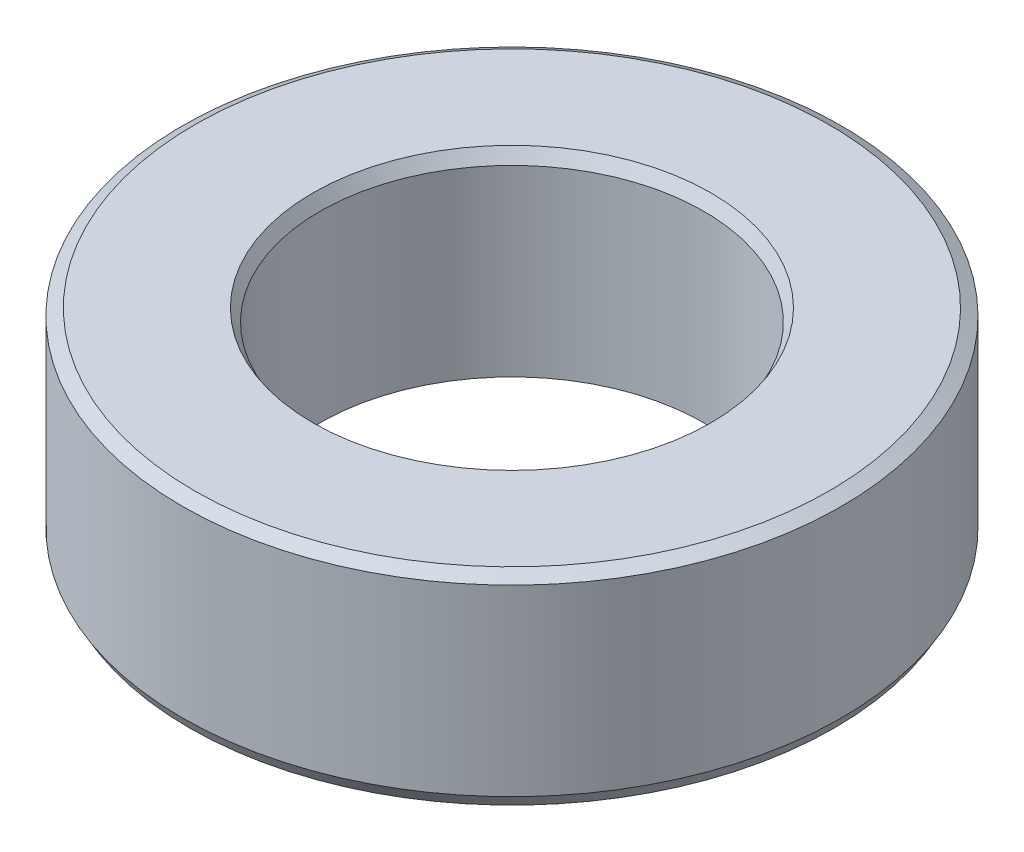
from build123d import *
from OCP.BRepFilletAPI import BRepFilletAPI_MakeChamfer

# Parameters (mm, degrees)
SKETCH1_R           = 50
BOSS_EXTRUDE1_DEPTH = 30.749527947
SKETCH2_R           = 29.124470851
CUT_EXTRUDE1_DEPTH  = 78.107285447
CHAMFER1_SIZE       = 1.081938786
CHAMFER1_SIZE2      = 1.873972948


with BuildPart() as part:
    # Sketch1 → Boss-Extrude1 (new body)
    with BuildSketch(Plane(origin=(0, 0, 0), x_dir=(1, 0, 0), z_dir=(0, 1, 0))):
        Circle(SKETCH1_R)
    extrude(amount=BOSS_EXTRUDE1_DEPTH)

    # Sketch2 → Cut-Extrude1 (cut, through all)
    with BuildSketch(Plane(origin=(0, 0, 0), x_dir=(1, 0, 0), z_dir=(0, 1, 0))):
        Circle(SKETCH2_R)
    extrude(amount=CUT_EXTRUDE1_DEPTH, mode=Mode.SUBTRACT)

    # Chamfer1: one chamfer whose edges measure the first distance from different faces: ONE call of the kernel's chamfer builder (chamfer() names one face for all edges)
    chamfer1_edges_1 = [part.edges().sort_by_distance(p)[0] for p in [
        (-29.124470851, 30.749527947, 0),
    ]]
    chamfer1_side_1 = [part.faces().sort_by_distance(p)[0] for p in [
        (-48.585786438, 30.749527947, 0),
    ]]
    chamfer1_edges_2 = [part.edges().sort_by_distance(p)[0] for p in [
        (-29.124470851, 0, 0),
    ]]
    chamfer1_side_2 = [part.faces().sort_by_distance(p)[0] for p in [
        (-29.124470851, 15.374763973, 0),
    ]]
    chamfer1_edges_3 = [part.edges().sort_by_distance(p)[0] for p in [
        (-50, 0, 0),
    ]]
    chamfer1_side_3 = [part.faces().sort_by_distance(p)[0] for p in [
        (-48.585786438, 0, 0),
    ]]
    chamfer1_edges_4 = [part.edges().sort_by_distance(p)[0] for p in [
        (-50, 30.749527947, 0),
    ]]
    chamfer1_side_4 = [part.faces().sort_by_distance(p)[0] for p in [
        (-50, 15.374763973, 0),
    ]]
    chamfer1 = BRepFilletAPI_MakeChamfer(part.part.solid().wrapped)
    for e in chamfer1_edges_1:
        chamfer1.Add(CHAMFER1_SIZE, CHAMFER1_SIZE2, e.wrapped, chamfer1_side_1[0].wrapped)  # the first distance lies on this face
    for e in chamfer1_edges_2:
        chamfer1.Add(CHAMFER1_SIZE, CHAMFER1_SIZE2, e.wrapped, chamfer1_side_2[0].wrapped)  # the first distance lies on this face
    for e in chamfer1_edges_3:
        chamfer1.Add(CHAMFER1_SIZE, CHAMFER1_SIZE2, e.wrapped, chamfer1_side_3[0].wrapped)  # the first distance lies on this face
    for e in chamfer1_edges_4:
        chamfer1.Add(CHAMFER1_SIZE, CHAMFER1_SIZE2, e.wrapped, chamfer1_side_4[0].wrapped)  # the first distance lies on this face
    add(Compound.cast(chamfer1.Shape()), mode=Mode.REPLACE)


solid = part.part
